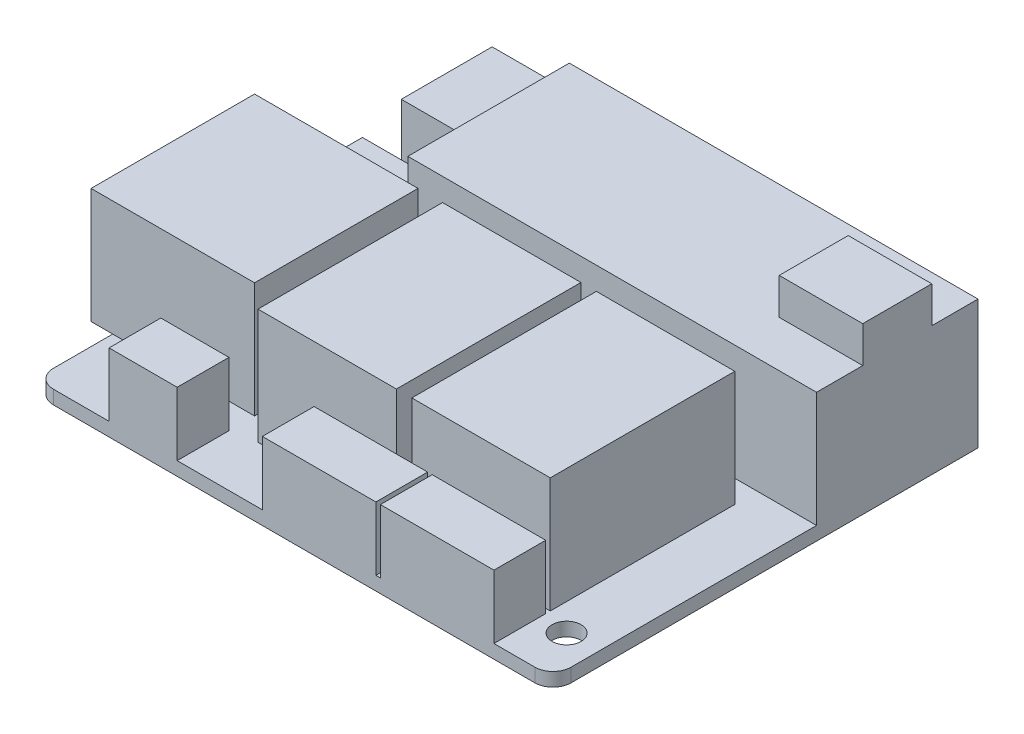
from build123d import *

# Parameters (mm, degrees)
SKETCH1_W             = 45
SKETCH1_H             = 17.78
BOSS_EXTRUDE1_DEPTH   = 12.7
SKETCH1_W_2           = 15.24
SKETCH1_H_2           = 20.32
BOSS_EXTRUDE1_2_DEPTH = 12.7
BOSS_EXTRUDE1_3_DEPTH = 12.7
SKETCH1_W_3           = 18
SKETCH1_H_3           = 18
BOSS_EXTRUDE1_4_DEPTH = 12.7
SKETCH2_W             = 12.5
SKETCH2_H             = 5.7
BOSS_EXTRUDE2_DEPTH   = 7
BOSS_EXTRUDE2_2_DEPTH = 7
SKETCH2_W_2           = 7.5
BOSS_EXTRUDE2_3_DEPTH = 7
SKETCH4_W             = 9
SKETCH4_H             = 27.5
BOSS_EXTRUDE4_DEPTH   = 5
SKETCH5_W             = 7.5
SKETCH5_H             = 10
BOSS_EXTRUDE5_DEPTH   = 10
SKETCH3_W             = 57
SKETCH3_H             = 46.8
SKETCH3_R             = 1.6
BOSS_EXTRUDE3_DEPTH   = 1.5
SKETCH6_W             = 9.2
SKETCH6_H             = 7.6
BOSS_EXTRUDE6_DEPTH   = 4
FILLET1_R             = 2


with BuildPart() as part:
    # Sketch1 → Boss-Extrude1 (new body)
    with BuildSketch(Plane(origin=(0, 0, 0), x_dir=(1, 0, 0), z_dir=(0, 1, 0))):
        with Locations((22.5, 8.89)):
            Rectangle(SKETCH1_W, SKETCH1_H)
    extrude(amount=BOSS_EXTRUDE1_DEPTH)



with BuildPart() as body_2:
    # Sketch1 → Boss-Extrude1 2 (new body)
    with BuildSketch(Plane(origin=(0, 0, 0), x_dir=(1, 0, 0), z_dir=(0, 1, 0))):
        with Locations((30.88, -12.66)):
            Rectangle(SKETCH1_W_2, SKETCH1_H_2)
    extrude(amount=BOSS_EXTRUDE1_2_DEPTH)


with BuildPart() as body_3:
    # Sketch1 → Boss-Extrude1 3 (new body)
    with BuildSketch(Plane(origin=(0, 0, 0), x_dir=(1, 0, 0), z_dir=(0, 1, 0))):
        with Locations((13.94, -12.66)):
            Rectangle(SKETCH1_W_2, SKETCH1_H_2)
    extrude(amount=BOSS_EXTRUDE1_3_DEPTH)


with BuildPart() as body_4:
    # Sketch1 → Boss-Extrude1 4 (new body)
    with BuildSketch(Plane(origin=(0, 0, 0), x_dir=(1, 0, 0), z_dir=(0, 1, 0))):
        with Locations((-5.38, -11.5)):
            Rectangle(SKETCH1_W_3, SKETCH1_H_3)
    extrude(amount=BOSS_EXTRUDE1_4_DEPTH)


with BuildPart() as body_5:
    # Sketch2 → Boss-Extrude2 (new body)
    with BuildSketch(Plane(origin=(0, 0, 0), x_dir=(1, 0, 0), z_dir=(0, 1, 0))):
        with Locations((32.25, -26.17)):
            Rectangle(SKETCH2_W, SKETCH2_H)
    extrude(amount=BOSS_EXTRUDE2_DEPTH)


with BuildPart() as body_6:
    # Sketch2 → Boss-Extrude2 2 (new body)
    with BuildSketch(Plane(origin=(0, 0, 0), x_dir=(1, 0, 0), z_dir=(0, 1, 0))):
        with Locations((19.25, -26.17)):
            Rectangle(SKETCH2_W, SKETCH2_H)
    extrude(amount=BOSS_EXTRUDE2_2_DEPTH)


with BuildPart() as body_7:
    # Sketch2 → Boss-Extrude2 3 (new body)
    with BuildSketch(Plane(origin=(0, 0, 0), x_dir=(1, 0, 0), z_dir=(0, 1, 0))):
        with Locations((-0.13, -26.17)):
            Rectangle(SKETCH2_W_2, SKETCH2_H)
    extrude(amount=BOSS_EXTRUDE2_3_DEPTH)


with BuildPart() as body_8:
    # Sketch4 → Boss-Extrude4 (new body)
    with BuildSketch(Plane(origin=(0, 0, 0), x_dir=(1, 0, 0), z_dir=(0, 1, 0))):
        with Locations((-7.5, -6.75)):
            Rectangle(SKETCH4_W, SKETCH4_H)
    extrude(amount=BOSS_EXTRUDE4_DEPTH)


with BuildPart() as body_9:
    # Sketch5 → Boss-Extrude5 (new body)
    with BuildSketch(Plane(origin=(0, 0, 0), x_dir=(1, 0, 0), z_dir=(0, 1, 0))):
        with Locations((-4.75, 12.78)):
            Rectangle(SKETCH5_W, SKETCH5_H)
    extrude(amount=BOSS_EXTRUDE5_DEPTH)


with BuildPart() as part_1:
    add(part.part)

    add(body_2.part)  # Boss-Extrude3 merges body 2

    add(body_3.part)  # Boss-Extrude3 merges body 3

    add(body_4.part)  # Boss-Extrude3 merges body 4

    add(body_5.part)  # Boss-Extrude3 merges body 5

    add(body_6.part)  # Boss-Extrude3 merges body 6

    add(body_7.part)  # Boss-Extrude3 merges body 7

    add(body_8.part)  # Boss-Extrude3 merges body 8

    add(body_9.part)  # Boss-Extrude3 merges body 9
    # Sketch3 → Boss-Extrude3 (add)
    with BuildSketch(Plane(origin=(0, 0, 0), x_dir=(1, 0, 0), z_dir=(0, 1, 0))):
        with Locations((16.5, -5.62)):
            Rectangle(SKETCH3_W, SKETCH3_H)
        with Locations((41.5, -24.02)):
            Circle(SKETCH3_R, mode=Mode.SUBTRACT)
        with Locations((41.5, 8.48)):
            Circle(SKETCH3_R, mode=Mode.SUBTRACT)
        with Locations((18.5, 8.48)):
            Circle(SKETCH3_R, mode=Mode.SUBTRACT)
    extrude(amount=-BOSS_EXTRUDE3_DEPTH)

    # Sketch6 → Boss-Extrude6 (add)
    with BuildSketch(Plane(origin=(0, 12.7, 0), x_dir=(1, 0, 0), z_dir=(0, 1, 0))):
        with Locations((40.4, 8.89)):
            Rectangle(SKETCH6_W, SKETCH6_H)
    extrude(amount=BOSS_EXTRUDE6_DEPTH)

    # Fillet1
    fillet1_edges = [part_1.edges().sort_by_distance(p)[0] for p in [
        (45, -0.75, 29.02),
        (-12, -0.75, 29.02),
        (-12, -0.75, -17.78),
    ]]
    fillet(fillet1_edges, radius=FILLET1_R)


solid = part_1.part
